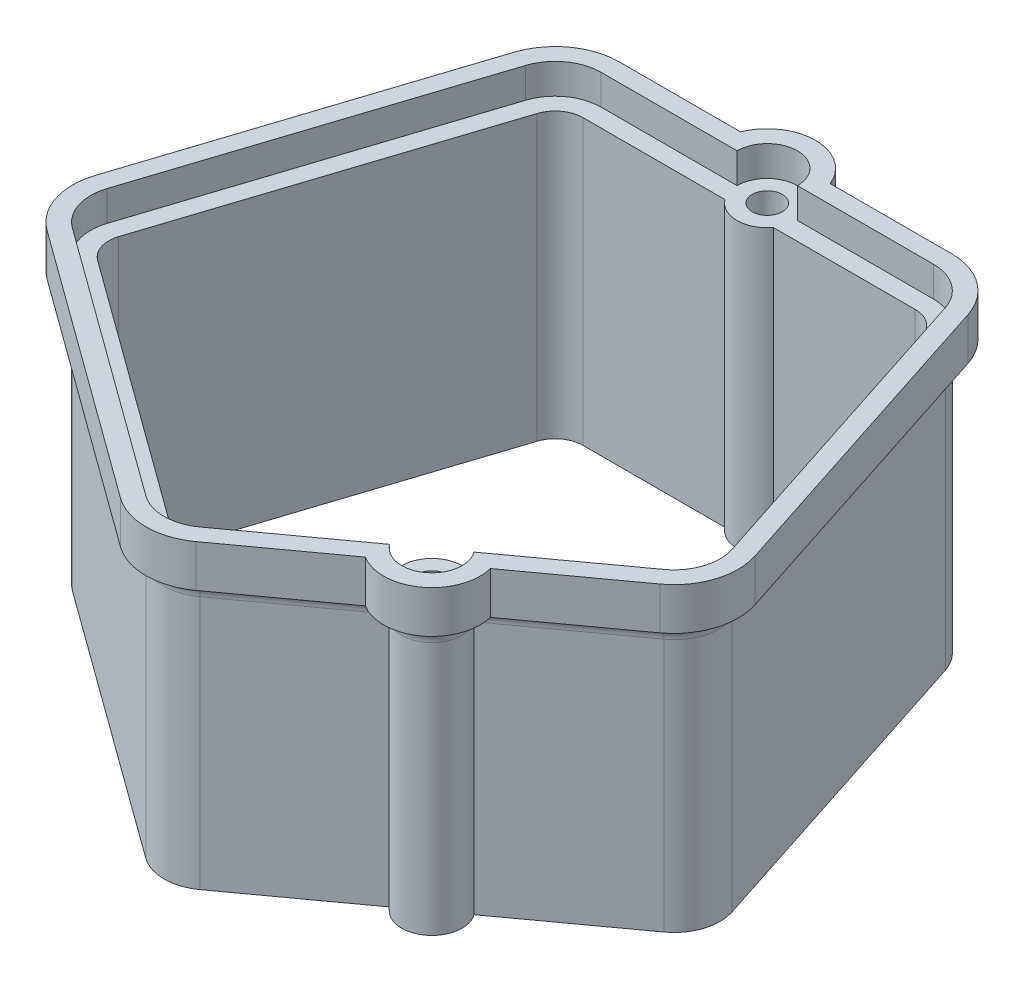
from build123d import *

# Parameters (mm, degrees)
SKETCH1_R                = 2.5
BOSS_EXTRUDE1_DEPTH      = 40
BOSS_EXTRUDE2_DEPTH      = 5
BOSS_EXTRUDE2_DEPTH_BACK = 2
FILLET1_R                = 3
BOSS_EXTRUDE3_START      = 7
SKETCH3_R                = 2.5
BOSS_EXTRUDE3_DEPTH      = 7


with BuildPart() as part:
    # Sketch1 → Boss-Extrude1 (new body)
    # profile 1 of 3: a face of its own
    with BuildSketch(Plane(origin=(0, 0, 0), x_dir=(1, 0, 0), z_dir=(0, 1, 0))):
        with BuildLine():
            Line((55.989380272, -10.721623107), (38.994348201, 41.58370731))
            ThreePointArc((38.994348201, 41.58370731), (36.22622117, 45.39370731), (31.747297547, 46.848997812))
            Line((31.747297547, 46.848997812), (9.248758018, 46.848997812))
            ThreePointArc((9.248758018, 46.848997812), (7.784291924, 50.384531718), (4.248758018, 51.848997812))
            Line((4.248758018, 51.848997812), (4.248758018, 50.848997812))
            ThreePointArc((4.248758018, 50.848997812), (1.420330893, 49.677424937), (0.248758018, 46.848997812))
            Line((0.248758018, 46.848997812), (-23.249781512, 46.848997812))
            ThreePointArc((-23.249781512, 46.848997812), (-27.728705135, 45.39370731), (-30.496832166, 41.58370731))
            Line((-30.496832166, 41.58370731), (-47.491864237, -10.721623107))
            ThreePointArc((-47.491864237, -10.721623107), (-47.491864237, -15.431042101), (-44.723737205, -19.241042101))
            Line((-44.723737205, -19.241042101), (-0.230165605, -51.567514092))
            ThreePointArc((-0.230165605, -51.567514092), (4.248758018, -53.022804594), (8.72768164, -51.567514092))
            Line((8.72768164, -51.567514092), (27.738399463, -37.755419106))
            ThreePointArc((27.738399463, -37.755419106), (30.34872958, -39.355031459), (33.325608449, -38.640346074))
            Line((33.325608449, -38.640346074), (33.913393702, -39.449363068))
            ThreePointArc((33.913393702, -39.449363068), (35.912909143, -36.186450422), (35.019552412, -32.465351835))
            Line((35.019552412, -32.465351835), (53.22125324, -19.241042101))
            ThreePointArc((53.22125324, -19.241042101), (55.989380272, -15.431042101), (55.989380272, -10.721623107))
        make_face()
        with Locations(Location((4.248758018, 46.848997812, 0), (0, 0, 270))):
            Circle(SKETCH1_R, mode=Mode.SUBTRACT)
        with Locations(Location((30.97446744, -35.404278096, 0), (0, 0, 270))):
            Circle(SKETCH1_R, mode=Mode.SUBTRACT)
        with BuildLine():
            ThreePointArc((-23.249781512, 43.848997812), (-25.965349378, 42.966656326), (-27.643662617, 40.656656326))
            Line((-27.643662617, 40.656656326), (-44.638694688, -11.64867409))
            ThreePointArc((-44.638694688, -11.64867409), (-44.638694688, -14.503991118), (-42.960381448, -16.813991118))
            Line((-42.960381448, -16.813991118), (1.533190152, -49.140463108))
            ThreePointArc((1.533190152, -49.140463108), (4.248758018, -50.022804594), (6.964325883, -49.140463108))
            Line((6.964325883, -49.140463108), (25.975043706, -35.328368122))
            ThreePointArc((25.975043706, -35.328368122), (28.035541179, -31.359193125), (32.447179661, -30.626086104))
            Line((32.447179661, -30.626086104), (51.457897483, -16.813991118))
            ThreePointArc((51.457897483, -16.813991118), (53.136210723, -14.503991118), (53.136210723, -11.64867409))
            Line((53.136210723, -11.64867409), (36.141178653, 40.656656326))
            ThreePointArc((36.141178653, 40.656656326), (34.462865413, 42.966656326), (31.747297547, 43.848997812))
            Line((31.747297547, 43.848997812), (8.248758018, 43.848997812))
            ThreePointArc((8.248758018, 43.848997812), (4.248758018, 41.848997812), (0.248758018, 43.848997812))
            Line((0.248758018, 43.848997812), (-23.249781512, 43.848997812))
        make_face(mode=Mode.SUBTRACT)
    # profile 2 of 3: a face of its own
    with BuildSketch(Plane(origin=(0, 0, 0), x_dir=(1, 0, 0), z_dir=(0, 1, 0))):
        with BuildLine():
            ThreePointArc((26.929382468, -38.343204358), (30.192295115, -40.342719799), (33.913393702, -39.449363068))
            Line((33.913393702, -39.449363068), (33.325608449, -38.640346074))
            ThreePointArc((33.325608449, -38.640346074), (30.34872958, -39.355031459), (27.738399463, -37.755419106))
            Line((27.738399463, -37.755419106), (26.929382468, -38.343204358))
        make_face()
    # profile 3 of 3: a face of its own
    with BuildSketch(Plane(origin=(0, 0, 0), x_dir=(1, 0, 0), z_dir=(0, 1, 0))):
        with BuildLine():
            Line((4.248758018, 50.848997812), (4.248758018, 51.848997812))
            ThreePointArc((4.248758018, 51.848997812), (0.713224112, 50.384531718), (-0.751241982, 46.848997812))
            Line((-0.751241982, 46.848997812), (0.248758018, 46.848997812))
            ThreePointArc((0.248758018, 46.848997812), (1.420330893, 49.677424937), (4.248758018, 50.848997812))
        make_face()
    extrude(amount=BOSS_EXTRUDE1_DEPTH)

    # Sketch2 → Boss-Extrude2 (add, two sides: drawn at the far end of the back side and taken through both)
    with BuildSketch(Plane(origin=(0, 40, 0), x_dir=(1, 0, 0), z_dir=(0, 1, 0)).offset(-BOSS_EXTRUDE2_DEPTH_BACK)):
        Polygon((-30.496832166, 41.58370731), (-33.350001715, 42.510758293), (-50.345033785, -9.794572124), (-47.491864237, -10.721623107), align=None)
        with BuildLine():
            Line((-1.993521362, -53.994565075), (-46.487092962, -21.668093084))
            ThreePointArc((-46.487092962, -21.668093084), (-50.345033785, -16.358093084), (-50.345033785, -9.794572124))
            Line((-50.345033785, -9.794572124), (-47.491864237, -10.721623107))
            ThreePointArc((-47.491864237, -10.721623107), (-47.491864237, -15.431042101), (-44.723737205, -19.241042101))
            Line((-44.723737205, -19.241042101), (-0.230165605, -51.567514092))
            ThreePointArc((-0.230165605, -51.567514092), (4.248758018, -53.022804594), (8.72768164, -51.567514092))
            Line((8.72768164, -51.567514092), (26.929382468, -38.343204358))
            ThreePointArc((26.929382468, -38.343204358), (33.913393702, -39.449363068), (35.019552412, -32.465351835))
            Line((35.019552412, -32.465351835), (53.22125324, -19.241042101))
            ThreePointArc((53.22125324, -19.241042101), (55.989380272, -15.431042101), (55.989380272, -10.721623107))
            Line((55.989380272, -10.721623107), (38.994348201, 41.58370731))
            ThreePointArc((38.994348201, 41.58370731), (36.22622117, 45.39370731), (31.747297547, 46.848997812))
            Line((31.747297547, 46.848997812), (9.248758018, 46.848997812))
            ThreePointArc((9.248758018, 46.848997812), (4.248758018, 51.848997812), (-0.751241982, 46.848997812))
            Line((-0.751241982, 46.848997812), (-23.249781512, 46.848997812))
            Line((-23.249781512, 46.848997812), (-23.249781512, 49.848997812))
            Line((-23.249781512, 49.848997812), (-3.16744047, 49.848997812))
            ThreePointArc((-3.16744047, 49.848997812), (4.248758018, 54.848997812), (11.664956505, 49.848997812))
            Line((11.664956505, 49.848997812), (31.747297547, 49.848997812))
            ThreePointArc((31.747297547, 49.848997812), (37.989576927, 47.820758293), (41.84751775, 42.510758293))
            Line((41.84751775, 42.510758293), (58.842549821, -9.794572124))
            ThreePointArc((58.842549821, -9.794572124), (58.842549821, -16.358093084), (54.984608997, -21.668093084))
            Line((54.984608997, -21.668093084), (38.737653807, -33.472196981))
            ThreePointArc((38.737653807, -33.472196981), (35.676749458, -41.876414051), (26.737992587, -42.190461178))
            Line((26.737992587, -42.190461178), (10.491037397, -53.994565075))
            ThreePointArc((10.491037397, -53.994565075), (4.248758018, -56.022804594), (-1.993521362, -53.994565075))
        make_face()
        with BuildLine():
            ThreePointArc((-33.350001715, 42.510758293), (-29.492060891, 47.820758293), (-23.249781512, 49.848997812))
            Line((-23.249781512, 49.848997812), (-23.249781512, 46.848997812))
            ThreePointArc((-23.249781512, 46.848997812), (-27.728705135, 45.39370731), (-30.496832166, 41.58370731))
            Line((-30.496832166, 41.58370731), (-33.350001715, 42.510758293))
        make_face()
    extrude(amount=BOSS_EXTRUDE2_DEPTH + BOSS_EXTRUDE2_DEPTH_BACK)

    # Fillet1
    fillet1_edges = [part.edges().sort_by_distance(p)[0] for p in [
        (-38.994348201, 38, -15.431042101),
        (-47.491864237, 38, 15.431042101),
        (-22.476951405, 38, 35.404278096),
        (4.248758018, 38, 53.022804594),
        (17.828532054, 38, 44.955359225),
        (33.913393702, 38, 39.449363068),
        (44.120402826, 38, 25.853196968),
        (55.989380272, 38, 15.431042101),
        (47.491864237, 38, -15.431042101),
        (36.22622117, 38, -45.39370731),
        (20.498027782, 38, -46.848997812),
        (4.248758018, 38, -51.848997812),
        (-12.000511747, 38, -46.848997812),
        (-27.728705135, 38, -45.39370731),
    ]]
    fillet(fillet1_edges, radius=FILLET1_R - 0.0001)  # a hair under: the kernel refuses the full size

    # Sketch3 → Boss-Extrude3 (add)
    with BuildSketch(Plane.XZ.offset(BOSS_EXTRUDE3_START)):
        with BuildLine():
            Line((38.994348201, -41.58370731), (55.989380272, 10.721623107))
            ThreePointArc((55.989380272, 10.721623107), (55.989380272, 15.431042101), (53.22125324, 19.241042101))
            Line((53.22125324, 19.241042101), (35.019552412, 32.465351835))
            ThreePointArc((35.019552412, 32.465351835), (33.913393702, 39.449363068), (26.929382468, 38.343204358))
            Line((26.929382468, 38.343204358), (8.72768164, 51.567514092))
            ThreePointArc((8.72768164, 51.567514092), (4.248758018, 53.022804594), (-0.230165605, 51.567514092))
            Line((-0.230165605, 51.567514092), (-44.723737205, 19.241042101))
            ThreePointArc((-44.723737205, 19.241042101), (-47.491864237, 15.431042101), (-47.491864237, 10.721623107))
            Line((-47.491864237, 10.721623107), (-30.496832166, -41.58370731))
            ThreePointArc((-30.496832166, -41.58370731), (-27.728705135, -45.39370731), (-23.249781512, -46.848997812))
            Line((-23.249781512, -46.848997812), (-0.751241982, -46.848997812))
            ThreePointArc((-0.751241982, -46.848997812), (4.248758018, -51.848997812), (9.248758018, -46.848997812))
            Line((9.248758018, -46.848997812), (31.747297547, -46.848997812))
            ThreePointArc((31.747297547, -46.848997812), (36.22622117, -45.39370731), (38.994348201, -41.58370731))
        make_face()
        with Locations(Location((30.97446744, 35.404278096, 0), (0, 0, 270))):
            Circle(SKETCH3_R, mode=Mode.SUBTRACT)
        with Locations(Location((4.248758018, -46.848997812, 0), (0, 0, 270))):
            Circle(SKETCH3_R, mode=Mode.SUBTRACT)
        with BuildLine():
            Line((-44.638694688, 11.64867409), (-27.643662617, -40.656656326))
            ThreePointArc((-27.643662617, -40.656656326), (-25.965349378, -42.966656326), (-23.249781512, -43.848997812))
            Line((-23.249781512, -43.848997812), (0.248758018, -43.848997812))
            ThreePointArc((0.248758018, -43.848997812), (4.248758018, -41.848997812), (8.248758018, -43.848997812))
            Line((8.248758018, -43.848997812), (31.747297547, -43.848997812))
            ThreePointArc((31.747297547, -43.848997812), (34.462865413, -42.966656326), (36.141178653, -40.656656326))
            Line((36.141178653, -40.656656326), (53.136210723, 11.64867409))
            ThreePointArc((53.136210723, 11.64867409), (53.136210723, 14.503991118), (51.457897483, 16.813991118))
            Line((51.457897483, 16.813991118), (32.447179661, 30.626086104))
            ThreePointArc((32.447179661, 30.626086104), (28.035541179, 31.359193125), (25.975043706, 35.328368122))
            Line((25.975043706, 35.328368122), (6.964325883, 49.140463108))
            ThreePointArc((6.964325883, 49.140463108), (4.248758018, 50.022804594), (1.533190152, 49.140463108))
            Line((1.533190152, 49.140463108), (-42.960381448, 16.813991118))
            ThreePointArc((-42.960381448, 16.813991118), (-44.638694688, 14.503991118), (-44.638694688, 11.64867409))
        make_face(mode=Mode.SUBTRACT)
    extrude(amount=-BOSS_EXTRUDE3_DEPTH)


solid = part.part
